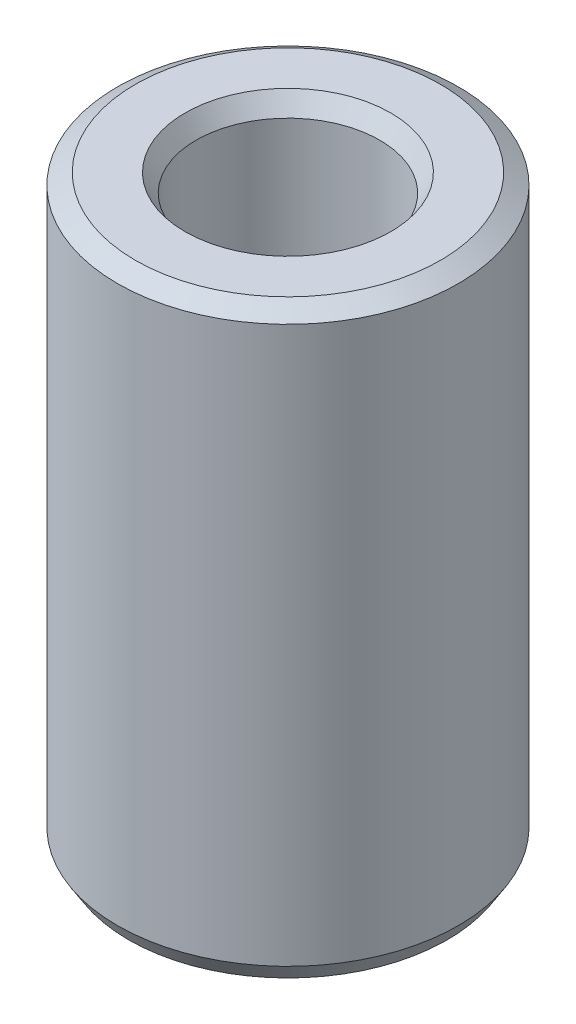
from build123d import *
from OCP.BRepFilletAPI import BRepFilletAPI_MakeChamfer

# Parameters (mm, degrees)
SKETCH1_R           = 52.5
BOSS_EXTRUDE1_DEPTH = 180.201495893
SKETCH2_R           = 28.254219157
CUT_EXTRUDE1_DEPTH  = 195.897611894
CHAMFER1_SIZE       = 3.429767918
CHAMFER1_SIZE2      = 5.52573291


with BuildPart() as part:
    # Sketch1 → Boss-Extrude1 (new body)
    with BuildSketch(Plane(origin=(0, 0, 0), x_dir=(1, 0, 0), z_dir=(0, 1, 0))):
        Circle(SKETCH1_R)
    extrude(amount=BOSS_EXTRUDE1_DEPTH)

    # Sketch2 → Cut-Extrude1 (cut, through all)
    with BuildSketch(Plane(origin=(0, 0, 0), x_dir=(1, 0, 0), z_dir=(0, 1, 0))):
        Circle(SKETCH2_R)
    extrude(amount=CUT_EXTRUDE1_DEPTH, mode=Mode.SUBTRACT)

    # Chamfer1: one chamfer whose edges measure the first distance from different faces: ONE call of the kernel's chamfer builder (chamfer() names one face for all edges)
    chamfer1_edges_1 = [part.edges().sort_by_distance(p)[0] for p in [
        (-28.254219157, 180.201495893, 0),
    ]]
    chamfer1_side_1 = [part.faces().sort_by_distance(p)[0] for p in [
        (-51.01507576, 180.201495893, 0),
    ]]
    chamfer1_edges_2 = [part.edges().sort_by_distance(p)[0] for p in [
        (-28.254219157, 0, 0),
    ]]
    chamfer1_side_2 = [part.faces().sort_by_distance(p)[0] for p in [
        (-28.254219157, 90.100747947, 0),
    ]]
    chamfer1_edges_3 = [part.edges().sort_by_distance(p)[0] for p in [
        (-52.5, 0, 0),
    ]]
    chamfer1_side_3 = [part.faces().sort_by_distance(p)[0] for p in [
        (-51.01507576, 0, 0),
    ]]
    chamfer1_edges_4 = [part.edges().sort_by_distance(p)[0] for p in [
        (-52.5, 180.201495893, 0),
    ]]
    chamfer1_side_4 = [part.faces().sort_by_distance(p)[0] for p in [
        (-52.5, 90.100747947, 0),
    ]]
    chamfer1 = BRepFilletAPI_MakeChamfer(part.part.solid().wrapped)
    for e in chamfer1_edges_1:
        chamfer1.Add(CHAMFER1_SIZE, CHAMFER1_SIZE2, e.wrapped, chamfer1_side_1[0].wrapped)  # the first distance lies on this face
    for e in chamfer1_edges_2:
        chamfer1.Add(CHAMFER1_SIZE, CHAMFER1_SIZE2, e.wrapped, chamfer1_side_2[0].wrapped)  # the first distance lies on this face
    for e in chamfer1_edges_3:
        chamfer1.Add(CHAMFER1_SIZE, CHAMFER1_SIZE2, e.wrapped, chamfer1_side_3[0].wrapped)  # the first distance lies on this face
    for e in chamfer1_edges_4:
        chamfer1.Add(CHAMFER1_SIZE, CHAMFER1_SIZE2, e.wrapped, chamfer1_side_4[0].wrapped)  # the first distance lies on this face
    add(Compound.cast(chamfer1.Shape()), mode=Mode.REPLACE)


solid = part.part
